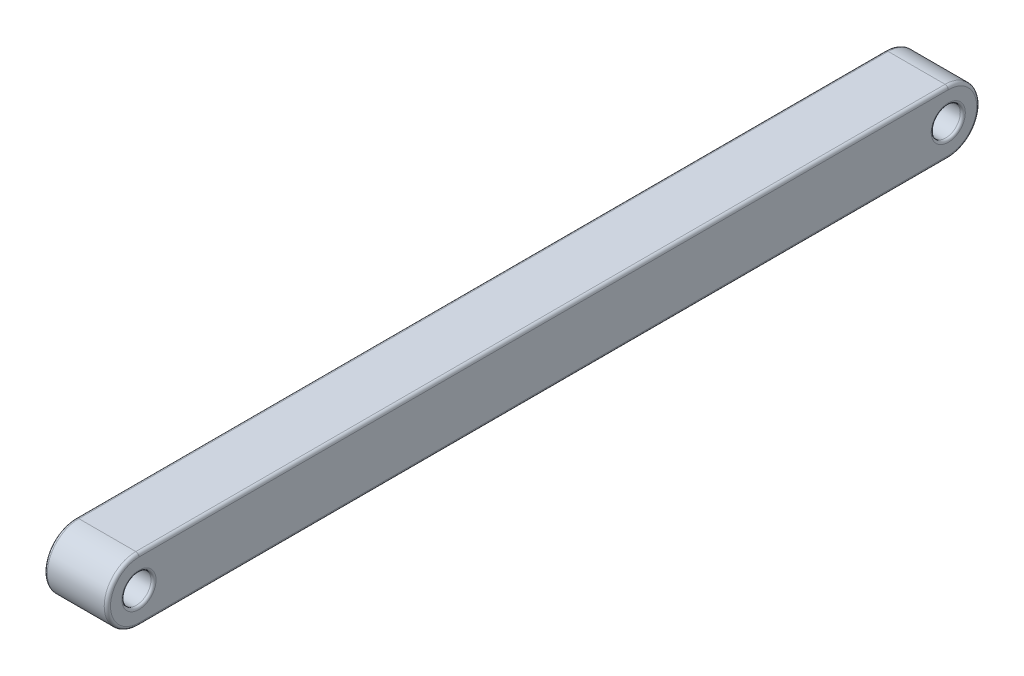
from build123d import *

# Parameters (mm, degrees)
SKETCH1_R           = 0.575
BOSS_EXTRUDE1_DEPTH = 2.5
FILLET1_R           = 0.125
FILLET2_R           = 0.1


with BuildPart() as part:
    # Sketch1 → Boss-Extrude1 (new body)
    with BuildSketch(Plane(origin=(0, 0, 0), x_dir=(0, 0, -1), z_dir=(1, 0, 0))):
        with BuildLine():
            Line((30, 0), (0, 0))
            Line((0, 0), (-1, 0))
            ThreePointArc((-1, 0), (-2.25, -1.25), (-1, -2.5))
            Line((-1, -2.5), (0, -2.5))
            Line((0, -2.5), (30, -2.5))
            Line((30, -2.5), (31, -2.5))
            ThreePointArc((31, -2.5), (32.25, -1.25), (31, 0))
            Line((31, 0), (30, 0))
        make_face()
        with Locations((-1, -1.25)):
            Circle(SKETCH1_R, mode=Mode.SUBTRACT)
        with Locations((31, -1.25)):
            Circle(SKETCH1_R, mode=Mode.SUBTRACT)
    extrude(amount=BOSS_EXTRUDE1_DEPTH)

    # Fillet1
    fillet1_edges = [part.edges().sort_by_distance(p)[0] for p in [
        (2.5, -1.25, -32.25),
        (2.5, 0, -15),
        (2.5, -1.25, 2.25),
        (0, -1.25, -32.25),
        (0, 0, -15),
        (0, -1.25, 2.25),
        (2.5, -2.5, -15),
        (0, -2.5, -15),
    ]]
    fillet(fillet1_edges, radius=FILLET1_R)

    # Fillet2
    fillet2_edges = [part.edges().sort_by_distance(p)[0] for p in [
        (0, -1.25, -30.425),
        (2.5, -1.25, -30.425),
        (0, -1.25, 1.575),
        (2.5, -1.25, 1.575),
    ]]
    fillet(fillet2_edges, radius=FILLET2_R)


solid = part.part
